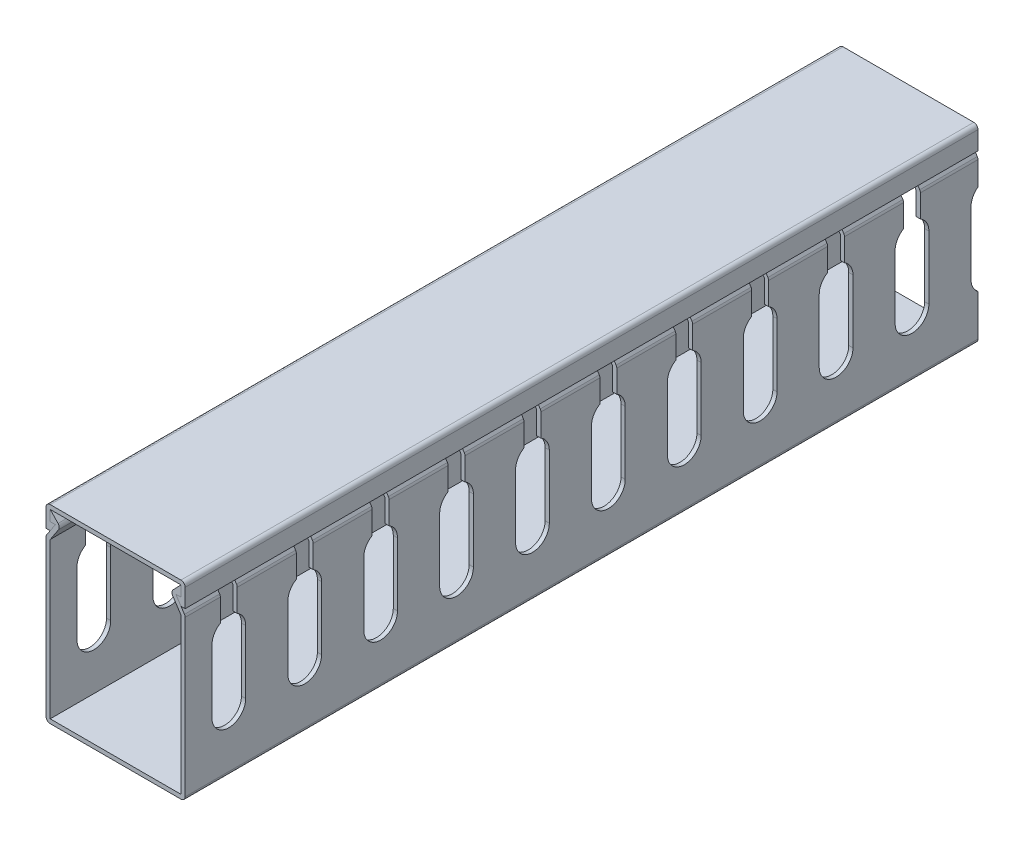
from build123d import *

# Parameters (mm, degrees)
BOSS_EXTRUDE1_DEPTH = 850
BOSS_EXTRUDE2_DEPTH = 850
CUT_EXTRUDE1_DEPTH  = 852.829795206
LPATTERN1_COUNT     = 94
LPATTERN1_PITCH     = 18
SKETCH7_W           = 861.380255454
SKETCH7_H           = 2173.003339948
SKETCH7_W_2         = 114.134313802
SKETCH7_H_2         = 188
CUT_EXTRUDE2_DEPTH  = 1339


with BuildPart() as part:
    # Sketch4 → Boss-Extrude1 (new, symmetric)
    with BuildSketch(Plane.XY):
        with BuildLine():
            Line((-15.5, 1), (-15.5, 37.834592439))
            Line((-15.5, 37.834592439), (-13.524103583, 40.820408077))
            ThreePointArc((-13.524103583, 40.820408077), (-13.36216977, 41.463091663), (-13.637685416, 42.065881742))
            Line((-13.637685416, 42.065881742), (-15.5, 44))
            Line((-15.5, 44), (-15.5, 41.488652376))
            Line((-15.5, 41.488652376), (-14.281021763, 41.488652376))
            Line((-14.281021763, 41.488652376), (-16.333933618, 38.386457205))
            ThreePointArc((-16.333933618, 38.386457205), (-16.457583839, 38.122747242), (-16.5, 37.834592439))
            Line((-16.5, 37.834592439), (-16.5, 1))
            ThreePointArc((-16.5, 1), (-16.207106781, 0.292893219), (-15.5, 0))
            Line((-15.5, 0), (15.5, 0))
            ThreePointArc((15.5, 0), (16.207106781, 0.292893219), (16.5, 1))
            Line((16.5, 1), (16.5, 37.834592439))
            ThreePointArc((16.5, 37.834592439), (16.457583839, 38.122747242), (16.333933618, 38.386457205))
            Line((16.333933618, 38.386457205), (14.281021763, 41.488652376))
            Line((14.281021763, 41.488652376), (15.5, 41.488652376))
            Line((15.5, 41.488652376), (15.5, 44))
            Line((15.5, 44), (13.637685416, 42.065881742))
            ThreePointArc((13.637685416, 42.065881742), (13.36216977, 41.463091663), (13.524103583, 40.820408077))
            Line((13.524103583, 40.820408077), (15.5, 37.834592439))
            Line((15.5, 37.834592439), (15.5, 1))
            Line((15.5, 1), (-15.5, 1))
        make_face()
    extrude(amount=BOSS_EXTRUDE1_DEPTH, both=True)

    # Sketch6 → Cut-Extrude1 (cut, through all)
    with BuildSketch(Plane(origin=(16.5, 0, 0), x_dir=(0, 0, -1), z_dir=(1, 0, 0))):
        with BuildLine():
            Line((-835.65, 29), (-835.65, 14))
            ThreePointArc((-835.65, 14), (-839.65, 10), (-843.65, 14))
            Line((-843.65, 14), (-843.65, 29))
            ThreePointArc((-843.65, 29), (-843.114101615, 31), (-841.65, 32.464101615))
            Line((-841.65, 32.464101615), (-841.65, 44))
            Line((-841.65, 44), (-837.65, 44))
            Line((-837.65, 44), (-837.65, 32.464101615))
            ThreePointArc((-837.65, 32.464101615), (-836.185898385, 31), (-835.65, 29))
        make_face()
    cut_extrude1 = extrude(amount=-CUT_EXTRUDE1_DEPTH, mode=Mode.SUBTRACT)

    # LPattern1: Cut-Extrude1 ×94
    with Locations(*[(0, 0, -i * LPATTERN1_PITCH) for i in range(1, LPATTERN1_COUNT)]):
        add(cut_extrude1, mode=Mode.SUBTRACT)


with BuildPart() as body_2:
    # Sketch5 → Boss-Extrude2 (new, symmetric)
    with BuildSketch(Plane.XY):
        with BuildLine():
            Line((-14.281021763, 41.488652376), (-15.515794777, 39.622762775))
            Line((-15.515794777, 39.622762775), (-16.5, 39.622762775))
            Line((-16.5, 39.622762775), (-16.5, 44))
            ThreePointArc((-16.5, 44), (-16.207106781, 44.707106781), (-15.5, 45))
            Line((-15.5, 45), (15.5, 45))
            ThreePointArc((15.5, 45), (16.207106781, 44.707106781), (16.5, 44))
            Line((16.5, 44), (16.5, 39.622762775))
            Line((16.5, 39.622762775), (15.515794777, 39.622762775))
            Line((15.515794777, 39.622762775), (14.281021763, 41.488652376))
            Line((14.281021763, 41.488652376), (15.5, 41.488652376))
            Line((15.5, 41.488652376), (15.5, 44))
            Line((15.5, 44), (-15.5, 44))
            Line((-15.5, 44), (-15.5, 41.488652376))
            Line((-15.5, 41.488652376), (-14.281021763, 41.488652376))
        make_face()
    extrude(amount=BOSS_EXTRUDE2_DEPTH, both=True)


with BuildPart() as cut_extrude2_tool:
    # Sketch7 → Cut-Extrude2 (new body)
    with BuildSketch(Plane(origin=(0, 45, 0), x_dir=(1, 0, 0), z_dir=(0, 1, 0))):
        with Locations((387.999995213, 168.031282802)):
            Rectangle(SKETCH7_W, SKETCH7_H)
        with Locations((33.263421372, -756)):
            Rectangle(SKETCH7_W_2, SKETCH7_H_2, mode=Mode.SUBTRACT)
    extrude(amount=-CUT_EXTRUDE2_DEPTH)


with BuildPart() as part_1:
    add(part.part)

    # Cut-Extrude2: cut by cut_extrude2_tool
    add(cut_extrude2_tool.part, mode=Mode.SUBTRACT)


with BuildPart() as body_2_1:
    add(body_2.part)

    # Cut-Extrude2: cut by cut_extrude2_tool
    add(cut_extrude2_tool.part, mode=Mode.SUBTRACT)


solid = Compound([part_1.part, body_2_1.part])
